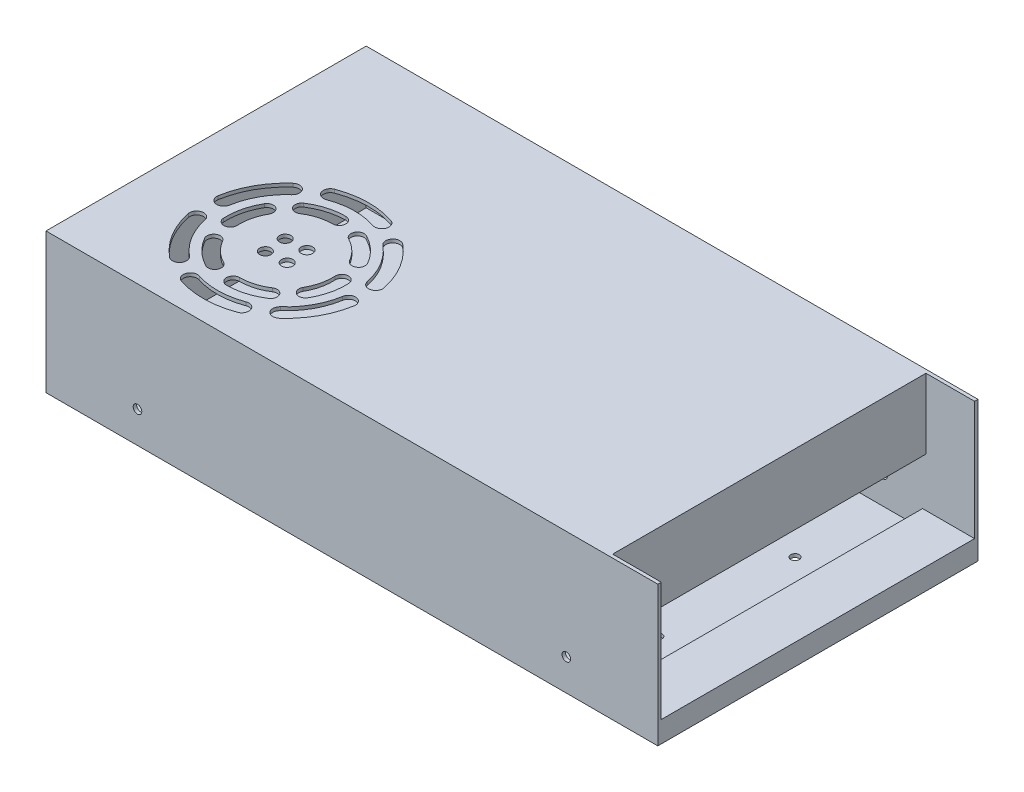
from build123d import *

# Parameters (mm, degrees)
SKETCH1_W           = 214
SKETCH1_H           = 112
BOSS_EXTRUDE1_DEPTH = 49
SKETCH2_W           = 18.2
SKETCH2_H           = 109.6
CUT_EXTRUDE1_DEPTH  = 41.6
SHELL1_START        = -54.8
SHELL1_DEPTH        = 109.6
SKETCH3_R           = 1.5
CUT_EXTRUDE2_DEPTH  = 10
CUT_EXTRUDE3_START  = -10
SKETCH4_R           = 1.5
CUT_EXTRUDE3_DEPTH  = 10
SKETCH5_W           = 109.6
SKETCH5_H           = 24.5
BOSS_EXTRUDE2_DEPTH = 1.2
SKETCH6_R           = 1.998023928
CUT_EXTRUDE5_DEPTH  = 10
SKETCH7_R           = 1.5
CUT_EXTRUDE6_DEPTH  = 10


# Read off the part's stored shape, not the designer's step: Shell1
with BuildPart() as part:
    # Sketch1 → Boss-Extrude1 (new body)
    with BuildSketch(Plane(origin=(0, 0, 0), x_dir=(1, 0, 0), z_dir=(0, 1, 0))):
        Rectangle(SKETCH1_W, SKETCH1_H)
    extrude(amount=BOSS_EXTRUDE1_DEPTH)

    # Sketch2 → Cut-Extrude1 (cut)
    with BuildSketch(Plane(origin=(0, 49, 0), x_dir=(1, 0, 0), z_dir=(0, 1, 0))):
        with Locations((97.9, 0)):
            Rectangle(SKETCH2_W, SKETCH2_H)
    extrude(amount=-CUT_EXTRUDE1_DEPTH, mode=Mode.SUBTRACT)

    # Shell1 outline → Shell1 (cut)
    with BuildSketch(Plane.XY.offset(SHELL1_START)):
        Polygon((88.8, 6.2), (88.8, 47.8), (-105.8, 47.8), (-105.8, 1.2), (105.8, 1.2), (105.8, 6.2), align=None)
    extrude(amount=SHELL1_DEPTH, mode=Mode.SUBTRACT)

    # Sketch3 → Cut-Extrude2 (cut)
    with BuildSketch(Plane.XY.offset(56)):
        with Locations((75, 11)):
            Circle(SKETCH3_R)
        with Locations((-75, 11)):
            Circle(SKETCH3_R)
    extrude(amount=-CUT_EXTRUDE2_DEPTH, mode=Mode.SUBTRACT)

    # Sketch4 → Cut-Extrude3 (cut)
    with BuildSketch(Plane(origin=(0, 0, -56), x_dir=(-1, 0, 0), z_dir=(0, 0, -1)).offset(CUT_EXTRUDE3_START)):
        with Locations(Location((-75, 11, 0), (0, 0, 180))):
            Circle(SKETCH4_R)
        with Locations((-75, 36)):
            Circle(SKETCH4_R)
        with Locations((75, 36)):
            Circle(SKETCH4_R)
        with Locations(Location((75, 11, 0), (0, 0, 180))):
            Circle(SKETCH4_R)
    extrude(amount=CUT_EXTRUDE3_DEPTH, mode=Mode.SUBTRACT)

    # Sketch5 → Boss-Extrude2 (add)
    with BuildSketch(Plane(origin=(88.8, 0, 0), x_dir=(0, 0, -1), z_dir=(1, 0, 0))):
        with Locations((0, 36.75)):
            Rectangle(SKETCH5_W, SKETCH5_H)
    extrude(amount=BOSS_EXTRUDE2_DEPTH)

    # Sketch6 → Cut-Extrude5 (cut)
    with BuildSketch(Plane(origin=(0, 49, 0), x_dir=(1, 0, 0), z_dir=(0, 1, 0))):
        with Locations(Location((-55.192236422, -23.459739828, 0), (0, 0, 270))):
            Circle(SKETCH6_R)
        with Locations(Location((-62.461489091, -23.807661774, 0), (0, 0, 270))):
            Circle(SKETCH6_R)
        with Locations(Location((-62.809411037, -16.538409104, 0), (0, 0, 270))):
            Circle(SKETCH6_R)
        with Locations(Location((-55.540158368, -16.190487158, 0), (0, 0, 270))):
            Circle(SKETCH6_R)
        with BuildLine():
            ThreePointArc((-68.111702611, -47.500442825), (-58.4348804, -48.96511902), (-48.822553365, -47.124104778))
            ThreePointArc((-48.822553365, -47.124104778), (-47.37733306, -43.943008007), (-50.558429832, -42.497787702))
            ThreePointArc((-50.558429832, -42.497787702), (-58.531267819, -44.024796535), (-66.557600615, -42.809937118))
            ThreePointArc((-66.557600615, -42.809937118), (-69.679904466, -44.378138973), (-68.111702611, -47.500442825))
        make_face()
        with BuildLine():
            ThreePointArc((-87.372467764, -25.85973106), (-83.802503452, -34.97244302), (-77.401974833, -42.376455301))
            ThreePointArc((-77.401974833, -42.376455301), (-73.924454064, -42.037504413), (-74.263404952, -38.559983645))
            ThreePointArc((-74.263404952, -38.559983645), (-79.572252387, -32.418807824), (-82.533319668, -24.860370016))
            ThreePointArc((-82.533319668, -24.860370016), (-85.452574238, -22.940476489), (-87.372467764, -25.85973106))
        make_face()
        with BuildLine():
            ThreePointArc((-78.261444197, 1.640936741), (-84.368302096, -6.007099023), (-87.580100511, -15.252125546))
            ThreePointArc((-87.580100511, -15.252125546), (-85.547800047, -18.09427143), (-82.705654164, -16.061970966))
            ThreePointArc((-82.705654164, -16.061970966), (-80.041663611, -8.393786313), (-74.976398096, -2.050207921))
            ThreePointArc((-74.976398096, -2.050207921), (-74.773348815, 1.437887461), (-78.261444197, 1.640936741))
        make_face()
        with BuildLine():
            ThreePointArc((-49.889655476, 7.500892778), (-59.566477687, 8.965568974), (-69.178804722, 7.124554732))
            ThreePointArc((-69.178804722, 7.124554732), (-70.624025026, 3.94345796), (-67.442928255, 2.498237655))
            ThreePointArc((-67.442928255, 2.498237655), (-59.470090268, 4.025246488), (-51.443757472, 2.810387072))
            ThreePointArc((-51.443757472, 2.810387072), (-48.321453621, 4.378588927), (-49.889655476, 7.500892778))
        make_face()
        with BuildLine():
            ThreePointArc((-30.628890323, -14.139818987), (-34.198854634, -5.027107026), (-40.599383254, 2.376905254))
            ThreePointArc((-40.599383254, 2.376905254), (-44.076904022, 2.037954367), (-43.737953135, -1.439566401))
            ThreePointArc((-43.737953135, -1.439566401), (-38.4291057, -7.580742222), (-35.468038419, -15.139180031))
            ThreePointArc((-35.468038419, -15.139180031), (-32.548783849, -17.059073557), (-30.628890323, -14.139818987))
        make_face()
        with BuildLine():
            ThreePointArc((-39.73991389, -41.640486788), (-33.633055991, -33.992451023), (-30.421257576, -24.7474245))
            ThreePointArc((-30.421257576, -24.7474245), (-32.453558039, -21.905278617), (-35.295703923, -23.93757908))
            ThreePointArc((-35.295703923, -23.93757908), (-37.959694476, -31.605763734), (-43.02495999, -37.949342126))
            ThreePointArc((-43.02495999, -37.949342126), (-43.228009271, -41.437437507), (-39.73991389, -41.640486788))
        make_face()
        with BuildLine():
            ThreePointArc((-59.000823729, -40.866828037), (-53.078604467, -40.008833538), (-47.643378837, -37.505404311))
            ThreePointArc((-47.643378837, -37.505404311), (-46.963644877, -34.314632642), (-50.154416546, -33.634898681))
            ThreePointArc((-50.154416546, -33.634898681), (-54.387958467, -35.584840284), (-59.000823729, -36.253139252))
            ThreePointArc((-59.000823729, -36.253139252), (-61.307668122, -38.559983645), (-59.000823729, -40.866828037))
        make_face()
        with BuildLine():
            ThreePointArc((-77.072828442, -30.432951252), (-73.368673779, -35.13274633), (-68.483027656, -38.588075187))
            ThreePointArc((-68.483027656, -38.588075187), (-65.379871353, -37.58135623), (-66.38659031, -34.478199926))
            ThreePointArc((-66.38659031, -34.478199926), (-70.192060234, -31.786815877), (-73.077256749, -28.126106859))
            ThreePointArc((-73.077256749, -28.126106859), (-76.228464792, -27.281743209), (-77.072828442, -30.432951252))
        make_face()
        with BuildLine():
            ThreePointArc((-77.072828442, -9.56519768), (-79.290893041, -15.122987258), (-79.840472548, -21.081745342))
            ThreePointArc((-79.840472548, -21.081745342), (-77.417050205, -23.265798054), (-75.232997493, -20.842375711))
            ThreePointArc((-75.232997493, -20.842375711), (-74.804925497, -16.201050059), (-73.077256749, -11.872042073))
            ThreePointArc((-73.077256749, -11.872042073), (-73.921620399, -8.72083403), (-77.072828442, -9.56519768))
        make_face()
        with BuildLine():
            ThreePointArc((-59.000823729, 0.868679105), (-64.923042991, 0.010684606), (-70.358268622, -2.492744621))
            ThreePointArc((-70.358268622, -2.492744621), (-71.038002582, -5.68351629), (-67.847230912, -6.36325025))
            ThreePointArc((-67.847230912, -6.36325025), (-63.613688992, -4.413308647), (-59.000823729, -3.74500968))
            ThreePointArc((-59.000823729, -3.74500968), (-56.693979337, -1.438165287), (-59.000823729, 0.868679105))
        make_face()
        with BuildLine():
            ThreePointArc((-40.928819017, -9.56519768), (-44.63297368, -4.865402602), (-49.518619803, -1.410073745))
            ThreePointArc((-49.518619803, -1.410073745), (-52.621776106, -2.416792702), (-51.615057149, -5.519949006))
            ThreePointArc((-51.615057149, -5.519949006), (-47.809587225, -8.211333055), (-44.92439071, -11.872042073))
            ThreePointArc((-44.92439071, -11.872042073), (-41.773182667, -12.716405723), (-40.928819017, -9.56519768))
        make_face()
        with BuildLine():
            ThreePointArc((-40.928819017, -30.432951252), (-38.710754418, -24.875161674), (-38.161174911, -18.91640359))
            ThreePointArc((-38.161174911, -18.91640359), (-40.584597254, -16.732350878), (-42.768649966, -19.155773221))
            ThreePointArc((-42.768649966, -19.155773221), (-43.196721962, -23.797098873), (-44.92439071, -28.126106859))
            ThreePointArc((-44.92439071, -28.126106859), (-44.080027059, -31.277314902), (-40.928819017, -30.432951252))
        make_face()
    extrude(amount=-CUT_EXTRUDE5_DEPTH, mode=Mode.SUBTRACT)

    # Sketch7 → Cut-Extrude6 (cut)
    with BuildSketch(Plane.XZ):
        with Locations(Location((-75, 24, 0), (0, 0, 270))):
            Circle(SKETCH7_R)
        with Locations(Location((75, 24, 0), (0, 0, 270))):
            Circle(SKETCH7_R)
        with Locations(Location((75, -24, 0), (0, 0, 270))):
            Circle(SKETCH7_R)
        with Locations(Location((-75, -24, 0), (0, 0, 270))):
            Circle(SKETCH7_R)
    extrude(amount=-CUT_EXTRUDE6_DEPTH, mode=Mode.SUBTRACT)


solid = part.part
